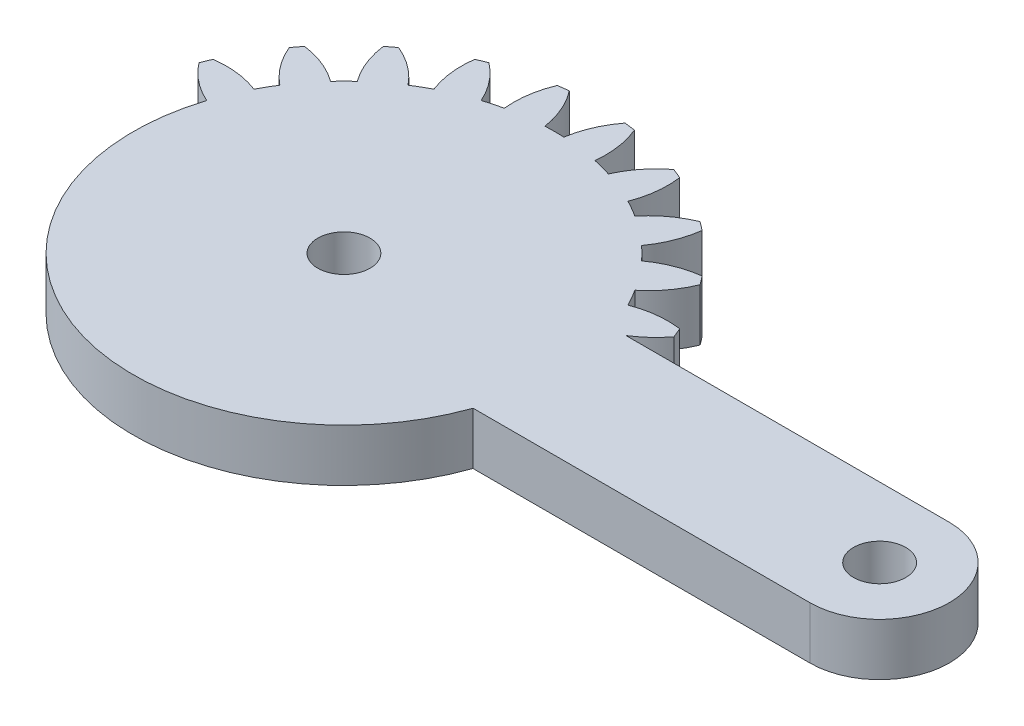
from build123d import *
from build123d.topology import SkipClean

# Parameters (mm, degrees)
SKETCH1_R           = 1.5
BOSS_EXTRUDE1_DEPTH = 3
CUT_EXTRUDE1_START  = -10
CUT_EXTRUDE1_DEPTH  = 10


with BuildPart() as part:
    # Sketch1 → Boss-Extrude1 (new body)
    with BuildSketch(Plane(origin=(0, 0, 0), x_dir=(1, 0, 0), z_dir=(0, 1, 0))):
        with BuildLine():
            Line((20.643657446, 4), (2.081641936, 4))
            ThreePointArc((2.081641936, 4), (2.861028333, 4.588201733), (3.521749436, 5.30713988))
            ThreePointArc((3.521749436, 5.30713988), (3.405395609, 5.596745198), (3.282888305, 5.883801663))
            ThreePointArc((3.282888305, 5.883801663), (1.93527598, 5.894040025), (0.627094961, 5.57027124))
            ThreePointArc((0.627094961, 5.57027124), (0.366286148, 6.046375), (0.084372603, 6.510293938))
            ThreePointArc((0.084372603, 6.510293938), (1.018855105, 7.48132754), (1.683794586, 8.65351323))
            ThreePointArc((1.683794586, 8.65351323), (1.496450048, 8.903135899), (1.303821399, 9.148703928))
            ThreePointArc((1.303821399, 9.148703928), (-0.000522033, 8.809805691), (-1.180330337, 8.158486898))
            ThreePointArc((-1.180330337, 8.158486898), (-1.555477026, 8.550865528), (-1.947855656, 8.926012217))
            ThreePointArc((-1.947855656, 8.926012217), (-1.296536862, 10.105820521), (-0.957638625, 11.410163953))
            ThreePointArc((-0.957638625, 11.410163953), (-1.203206655, 11.602792602), (-1.452829324, 11.79013714))
            ThreePointArc((-1.452829324, 11.79013714), (-2.625015014, 11.125197659), (-3.596048616, 10.190715157))
            ThreePointArc((-3.596048616, 10.190715157), (-4.059967554, 10.472628702), (-4.536071314, 10.733437515))
            ThreePointArc((-4.536071314, 10.733437515), (-4.212302529, 12.041618533), (-4.222540891, 13.389230859))
            ThreePointArc((-4.222540891, 13.389230859), (-4.509597355, 13.511738163), (-4.799202674, 13.62809199))
            ThreePointArc((-4.799202674, 13.62809199), (-5.759348103, 12.682425791), (-6.455432668, 11.528463019))
            ThreePointArc((-6.455432668, 11.528463019), (-6.976508546, 11.680699536), (-7.503891752, 11.809396783))
            ThreePointArc((-7.503891752, 11.809396783), (-7.529737283, 13.156800143), (-7.888414517, 14.455843809))
            ThreePointArc((-7.888414517, 14.455843809), (-8.197396993, 14.499881098), (-8.507248835, 14.537314892))
            ThreePointArc((-8.507248835, 14.537314892), (-9.18992168, 13.375367565), (-9.563620196, 12.080565177))
            ThreePointArc((-9.563620196, 12.080565177), (-10.106342554, 12.09275), (-10.649064912, 12.080565177))
            ThreePointArc((-10.649064912, 12.080565177), (-11.022763428, 13.375367565), (-11.705436272, 14.537314892))
            ThreePointArc((-11.705436272, 14.537314892), (-12.015288115, 14.499881098), (-12.324270591, 14.455843809))
            ThreePointArc((-12.324270591, 14.455843809), (-12.682947825, 13.156800143), (-12.708793355, 11.809396783))
            ThreePointArc((-12.708793355, 11.809396783), (-13.236176561, 11.680699536), (-13.757252439, 11.528463019))
            ThreePointArc((-13.757252439, 11.528463019), (-14.453337005, 12.682425791), (-15.413482434, 13.62809199))
            ThreePointArc((-15.413482434, 13.62809199), (-15.703087752, 13.511738163), (-15.990144217, 13.389230859))
            ThreePointArc((-15.990144217, 13.389230859), (-16.000382579, 12.041618533), (-15.676613793, 10.733437515))
            ThreePointArc((-15.676613793, 10.733437515), (-16.152717554, 10.472628702), (-16.616636492, 10.190715157))
            ThreePointArc((-16.616636492, 10.190715157), (-17.587670094, 11.125197659), (-18.759855783, 11.79013714))
            ThreePointArc((-18.759855783, 11.79013714), (-19.009478453, 11.602792602), (-19.255046482, 11.410163953))
            ThreePointArc((-19.255046482, 11.410163953), (-18.916148245, 10.105820521), (-18.264829452, 8.926012217))
            ThreePointArc((-18.264829452, 8.926012217), (-18.657208082, 8.550865528), (-19.032354771, 8.158486898))
            ThreePointArc((-19.032354771, 8.158486898), (-20.212163074, 8.809805691), (-21.516506507, 9.148703928))
            ThreePointArc((-21.516506507, 9.148703928), (-21.709135156, 8.903135899), (-21.896479694, 8.65351323))
            ThreePointArc((-21.896479694, 8.65351323), (-21.231540213, 7.48132754), (-20.297057711, 6.510293938))
            ThreePointArc((-20.297057711, 6.510293938), (-20.578971255, 6.046375), (-20.839780068, 5.57027124))
            ThreePointArc((-20.839780068, 5.57027124), (-22.147961087, 5.894040025), (-23.495573413, 5.883801663))
            ThreePointArc((-23.495573413, 5.883801663), (-23.618080717, 5.596745198), (-23.734434544, 5.30713988))
            ThreePointArc((-23.734434544, 5.30713988), (-22.788768345, 4.346994451), (-21.634805572, 3.650909885))
            ThreePointArc((-21.634805572, 3.650909885), (-21.78704209, 3.129834008), (-21.915739337, 2.602450802))
            ThreePointArc((-21.915739337, 2.602450802), (-23.263142697, 2.576605271), (-24.562186363, 2.217928037))
            ThreePointArc((-24.562186363, 2.217928037), (-24.606223651, 1.908945561), (-24.643657446, 1.599093719))
            ThreePointArc((-24.643657446, 1.599093719), (-23.481710119, 0.916420874), (-22.186907731, 0.542722358))
            ThreePointArc((-22.186907731, 0.542722358), (-22.199092554, 0), (-22.186907731, -0.542722358))
            ThreePointArc((-22.186907731, -0.542722358), (-23.481710119, -0.916420874), (-24.643657446, -1.599093719))
            ThreePointArc((-24.643657446, -1.599093719), (-24.606223651, -1.908945561), (-24.562186363, -2.217928037))
            ThreePointArc((-24.562186363, -2.217928037), (-23.263142697, -2.576605271), (-21.915739337, -2.602450802))
            ThreePointArc((-21.915739337, -2.602450802), (-21.78704209, -3.129834008), (-21.634805572, -3.650909885))
            ThreePointArc((-21.634805572, -3.650909885), (-22.788768345, -4.346994451), (-23.734434544, -5.30713988))
            ThreePointArc((-23.734434544, -5.30713988), (-23.618080717, -5.596745198), (-23.495573413, -5.883801663))
            ThreePointArc((-23.495573413, -5.883801663), (-22.147961087, -5.894040025), (-20.839780068, -5.57027124))
            ThreePointArc((-20.839780068, -5.57027124), (-20.578971255, -6.046375), (-20.297057711, -6.510293938))
            ThreePointArc((-20.297057711, -6.510293938), (-21.231540213, -7.48132754), (-21.896479694, -8.65351323))
            ThreePointArc((-21.896479694, -8.65351323), (-21.709135156, -8.903135899), (-21.516506507, -9.148703928))
            ThreePointArc((-21.516506507, -9.148703928), (-20.212163074, -8.809805691), (-19.032354771, -8.158486898))
            ThreePointArc((-19.032354771, -8.158486898), (-18.657208082, -8.550865528), (-18.264829452, -8.926012217))
            ThreePointArc((-18.264829452, -8.926012217), (-18.916148245, -10.105820521), (-19.255046482, -11.410163953))
            ThreePointArc((-19.255046482, -11.410163953), (-19.009478453, -11.602792602), (-18.759855783, -11.79013714))
            ThreePointArc((-18.759855783, -11.79013714), (-17.587670094, -11.125197659), (-16.616636492, -10.190715157))
            ThreePointArc((-16.616636492, -10.190715157), (-16.152717554, -10.472628702), (-15.676613793, -10.733437515))
            ThreePointArc((-15.676613793, -10.733437515), (-16.000382579, -12.041618533), (-15.990144217, -13.389230859))
            ThreePointArc((-15.990144217, -13.389230859), (-15.703087752, -13.511738163), (-15.413482434, -13.62809199))
            ThreePointArc((-15.413482434, -13.62809199), (-14.453337005, -12.682425791), (-13.757252439, -11.528463019))
            ThreePointArc((-13.757252439, -11.528463019), (-13.236176561, -11.680699536), (-12.708793355, -11.809396783))
            ThreePointArc((-12.708793355, -11.809396783), (-12.682947825, -13.156800143), (-12.324270591, -14.455843809))
            ThreePointArc((-12.324270591, -14.455843809), (-12.015288115, -14.499881098), (-11.705436272, -14.537314892))
            ThreePointArc((-11.705436272, -14.537314892), (-11.022763428, -13.375367565), (-10.649064912, -12.080565177))
            ThreePointArc((-10.649064912, -12.080565177), (-10.106342554, -12.09275), (-9.563620196, -12.080565177))
            ThreePointArc((-9.563620196, -12.080565177), (-9.18992168, -13.375367565), (-8.507248835, -14.537314892))
            ThreePointArc((-8.507248835, -14.537314892), (-8.197396993, -14.499881098), (-7.888414517, -14.455843809))
            ThreePointArc((-7.888414517, -14.455843809), (-7.529737283, -13.156800143), (-7.503891752, -11.809396783))
            ThreePointArc((-7.503891752, -11.809396783), (-6.976508546, -11.680699536), (-6.455432668, -11.528463019))
            ThreePointArc((-6.455432668, -11.528463019), (-5.759348103, -12.682425791), (-4.799202674, -13.62809199))
            ThreePointArc((-4.799202674, -13.62809199), (-4.509597355, -13.511738163), (-4.222540891, -13.389230859))
            ThreePointArc((-4.222540891, -13.389230859), (-4.212302529, -12.041618533), (-4.536071314, -10.733437515))
            ThreePointArc((-4.536071314, -10.733437515), (-4.059967554, -10.472628702), (-3.596048616, -10.190715157))
            ThreePointArc((-3.596048616, -10.190715157), (-2.625015014, -11.125197659), (-1.452829324, -11.79013714))
            ThreePointArc((-1.452829324, -11.79013714), (-1.203206655, -11.602792602), (-0.957638625, -11.410163953))
            ThreePointArc((-0.957638625, -11.410163953), (-1.296536862, -10.105820521), (-1.947855656, -8.926012217))
            ThreePointArc((-1.947855656, -8.926012217), (-1.555477026, -8.550865528), (-1.180330337, -8.158486898))
            ThreePointArc((-1.180330337, -8.158486898), (-0.000522033, -8.809805691), (1.303821399, -9.148703928))
            ThreePointArc((1.303821399, -9.148703928), (1.496450048, -8.903135899), (1.683794586, -8.65351323))
            ThreePointArc((1.683794586, -8.65351323), (1.018855105, -7.48132754), (0.084372603, -6.510293938))
            ThreePointArc((0.084372603, -6.510293938), (0.366286148, -6.046375), (0.627094961, -5.57027124))
            ThreePointArc((0.627094961, -5.57027124), (1.93527598, -5.894040025), (3.282888305, -5.883801663))
            ThreePointArc((3.282888305, -5.883801663), (3.405395609, -5.596745198), (3.521749436, -5.30713988))
            ThreePointArc((3.521749436, -5.30713988), (2.861028333, -4.588201733), (2.081641936, -4))
            Line((2.081641936, -4), (20.643657446, -4))
            ThreePointArc((20.643657446, -4), (24.643657446, 0), (20.643657446, 4))
        make_face()
        with Locations((-10.106342554, 0)):
            Circle(SKETCH1_R, mode=Mode.SUBTRACT)
        with Locations((20.643657446, 0)):
            Circle(SKETCH1_R, mode=Mode.SUBTRACT)
    extrude(amount=BOSS_EXTRUDE1_DEPTH)

    # Sketch2 → Cut-Extrude1 (cut)
    with SkipClean():  # the faces are left unmerged after this step: merging them gives an invalid solid
        with BuildSketch(Plane(origin=(0, 3, 0), x_dir=(1, 0, 0), z_dir=(0, 1, 0)).offset(CUT_EXTRUDE1_START)):
            with BuildLine():
                ThreePointArc((3.521749436, -5.30713988), (2.861028333, -4.588201733), (2.081641936, -4))
                Line((2.081641936, -4), (1.305695063, -4))
                ThreePointArc((1.305695063, -4), (0.994195953, -4.797149927), (0.627094961, -5.57027124))
                ThreePointArc((0.627094961, -5.57027124), (1.93527598, -5.894040025), (3.282888305, -5.883801663))
                ThreePointArc((3.282888305, -5.883801663), (3.405395609, -5.596745198), (3.521749436, -5.30713988))
            make_face()
            with BuildLine():
                ThreePointArc((1.683794586, -8.65351323), (1.018855105, -7.48132754), (0.084372603, -6.510293938))
                ThreePointArc((0.084372603, -6.510293938), (-0.512518948, -7.361599771), (-1.180330337, -8.158486898))
                ThreePointArc((-1.180330337, -8.158486898), (-0.000522033, -8.809805691), (1.303821399, -9.148703928))
                ThreePointArc((1.303821399, -9.148703928), (1.496450048, -8.903135899), (1.683794586, -8.65351323))
            make_face()
            with BuildLine():
                ThreePointArc((-0.957638625, -11.410163953), (-1.296536862, -10.105820521), (-1.947855656, -8.926012217))
                ThreePointArc((-1.947855656, -8.926012217), (-2.744742783, -9.593823606), (-3.596048616, -10.190715157))
                ThreePointArc((-3.596048616, -10.190715157), (-2.625015014, -11.125197659), (-1.452829324, -11.79013714))
                ThreePointArc((-1.452829324, -11.79013714), (-1.203206655, -11.602792602), (-0.957638625, -11.410163953))
            make_face()
            with BuildLine():
                ThreePointArc((-4.222540891, -13.389230859), (-4.212302529, -12.041618533), (-4.536071314, -10.733437515))
                ThreePointArc((-4.536071314, -10.733437515), (-5.478647477, -11.172244217), (-6.455432668, -11.528463019))
                ThreePointArc((-6.455432668, -11.528463019), (-5.759348103, -12.682425791), (-4.799202674, -13.62809199))
                ThreePointArc((-4.799202674, -13.62809199), (-4.509597355, -13.511738163), (-4.222540891, -13.389230859))
            make_face()
            with BuildLine():
                ThreePointArc((-7.888414517, -14.455843809), (-7.529737283, -13.156800143), (-7.503891752, -11.809396783))
                ThreePointArc((-7.503891752, -11.809396783), (-8.527921943, -11.989294847), (-9.563620196, -12.080565177))
                ThreePointArc((-9.563620196, -12.080565177), (-9.18992168, -13.375367565), (-8.507248835, -14.537314892))
                ThreePointArc((-8.507248835, -14.537314892), (-8.197396993, -14.499881098), (-7.888414517, -14.455843809))
            make_face()
            with BuildLine():
                ThreePointArc((-11.705436272, -14.537314892), (-11.022763428, -13.375367565), (-10.649064912, -12.080565177))
                ThreePointArc((-10.649064912, -12.080565177), (-11.684763165, -11.989294847), (-12.708793355, -11.809396783))
                ThreePointArc((-12.708793355, -11.809396783), (-12.682947825, -13.156800143), (-12.324270591, -14.455843809))
                ThreePointArc((-12.324270591, -14.455843809), (-12.015288115, -14.499881098), (-11.705436272, -14.537314892))
            make_face()
            with BuildLine():
                ThreePointArc((-15.413482434, -13.62809199), (-14.453337005, -12.682425791), (-13.757252439, -11.528463019))
                ThreePointArc((-13.757252439, -11.528463019), (-14.734037631, -11.172244217), (-15.676613793, -10.733437515))
                ThreePointArc((-15.676613793, -10.733437515), (-16.000382579, -12.041618533), (-15.990144217, -13.389230859))
                ThreePointArc((-15.990144217, -13.389230859), (-15.703087752, -13.511738163), (-15.413482434, -13.62809199))
            make_face()
            with BuildLine():
                ThreePointArc((-18.759855783, -11.79013714), (-17.587670094, -11.125197659), (-16.616636492, -10.190715157))
                ThreePointArc((-16.616636492, -10.190715157), (-17.467942324, -9.593823606), (-18.264829452, -8.926012217))
                ThreePointArc((-18.264829452, -8.926012217), (-18.916148245, -10.105820521), (-19.255046482, -11.410163953))
                ThreePointArc((-19.255046482, -11.410163953), (-19.009478453, -11.602792602), (-18.759855783, -11.79013714))
            make_face()
            with BuildLine():
                ThreePointArc((-21.516506507, -9.148703928), (-20.212163074, -8.809805691), (-19.032354771, -8.158486898))
                ThreePointArc((-19.032354771, -8.158486898), (-19.70016616, -7.361599771), (-20.297057711, -6.510293938))
                ThreePointArc((-20.297057711, -6.510293938), (-21.231540213, -7.48132754), (-21.896479694, -8.65351323))
                ThreePointArc((-21.896479694, -8.65351323), (-21.709135156, -8.903135899), (-21.516506507, -9.148703928))
            make_face()
            with BuildLine():
                ThreePointArc((-23.495573413, -5.883801663), (-22.147961087, -5.894040025), (-20.839780068, -5.57027124))
                ThreePointArc((-20.839780068, -5.57027124), (-21.278586771, -4.627695077), (-21.634805572, -3.650909885))
                ThreePointArc((-21.634805572, -3.650909885), (-22.788768345, -4.346994451), (-23.734434544, -5.30713988))
                ThreePointArc((-23.734434544, -5.30713988), (-23.618080717, -5.596745198), (-23.495573413, -5.883801663))
            make_face()
            with BuildLine():
                ThreePointArc((-24.562186363, -2.217928037), (-23.263142697, -2.576605271), (-21.915739337, -2.602450802))
                ThreePointArc((-21.915739337, -2.602450802), (-22.095637401, -1.578420611), (-22.186907731, -0.542722358))
                ThreePointArc((-22.186907731, -0.542722358), (-23.481710119, -0.916420874), (-24.643657446, -1.599093719))
                ThreePointArc((-24.643657446, -1.599093719), (-24.606223651, -1.908945561), (-24.562186363, -2.217928037))
            make_face()
            with BuildLine():
                ThreePointArc((-22.186907731, 0.542722358), (-22.095637401, 1.578420611), (-21.915739337, 2.602450802))
                ThreePointArc((-21.915739337, 2.602450802), (-23.263142697, 2.576605271), (-24.562186363, 2.217928037))
                ThreePointArc((-24.562186363, 2.217928037), (-24.606223651, 1.908945561), (-24.643657446, 1.599093719))
                ThreePointArc((-24.643657446, 1.599093719), (-23.481710119, 0.916420874), (-22.186907731, 0.542722358))
            make_face()
        extrude(amount=CUT_EXTRUDE1_DEPTH, mode=Mode.SUBTRACT)


solid = part.part
